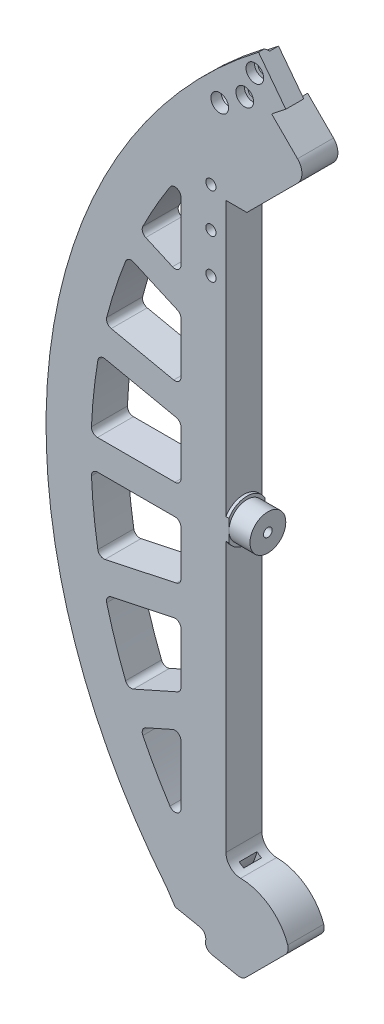
from build123d import *
from build123d.topology import SkipClean

# Parameters (mm, degrees)
AUFSATZ_LINEAR_AUSTRAGEN1_DEPTH       = 12
SKIZZE2_R                             = 5.975
AUFSATZ_LINEAR_AUSTRAGEN2_DEPTH       = 8
AUFSATZ_LINEAR_AUSTRAGEN3_DEPTH       = 1
SCHNITT_LINEAR_AUSTRAGEN1_DEPTH       = 255.841126979
VERRUNDUNG1_R                         = 2
VERRUNDUNG1_OF_SPIEGELN2_R            = 2
AUFSATZ_LINEAR_AUSTRAGEN4_DEPTH       = 12
SCHNITT_LINEAR_AUSTRAGEN2_DEPTH       = 255.841126979
VERRUNDUNG2_R                         = 5
VERRUNDUNG2_OF_SPIEGELN3_R            = 5
VERRUNDUNG3_R                         = 5
SCHNITT_LINEAR_AUSTRAGEN3_DEPTH       = 255.841126979
SKIZZE8_R                             = 217.169357413
SKIZZE8_R_2                           = 180
SCHNITT_LINEAR_AUSTRAGEN4_DEPTH       = 255.841126979
SKIZZE11_R                            = 1.7
SCHNITT_LINEAR_AUSTRAGEN6_DEPTH       = 255.841126979
AUFSATZ_LINEAR_AUSTRAGEN5_DEPTH       = 1
SKIZZE17_R                            = 1.7
SCHNITT_LINEAR_AUSTRAGEN9_DEPTH       = 255.841126979
SKIZZE17_7_R                          = 1.7
SCHNITT_LINEAR_AUSTRAGEN16_DEPTH      = 6
FASE1_SIZE                            = 1
SKIZZE21_R                            = 2.95
SCHNITT_LINEAR_AUSTRAGEN20_DEPTH      = 2.5
SCHNITT_LINEAR_AUSTRAGEN28_DEPTH      = 400.457969312
SKIZZE31_R                            = 2.9
SCHNITT_LINEAR_AUSTRAGEN29_DEPTH      = 6
SKIZZE33_R                            = 2.95
SCHNITT_LINEAR_AUSTRAGEN30_DEPTH      = 2.8
SKIZZE33_3_R                          = 2.95
SCHNITT_LINEAR_AUSTRAGEN44_DEPTH      = 4
FASE5_SIZE                            = 0.62
K_RPER_VERSCHIEBEN_KOPIEREN1_ANGLE    = 90
SCHNITT_ROTATION2_START               = -1.484065885
SCHNITT_ROTATION2_DEPTH               = 5.8
FASE2_SIZE                            = 1.1
SKIZZE37_R                            = 1.5
SCHNITT_LINEAR_AUSTRAGEN32_DEPTH      = 6
SCHNITT_LINEAR_AUSTRAGEN39_DEPTH      = 229.129577254
SCHNITT_LINEAR_AUSTRAGEN40_DEPTH      = 2.95
SKIZZE46_W                            = 20.526751733
SKIZZE46_H                            = 12
SCHNITT_LINEAR_AUSTRAGEN41_DEPTH      = 321.608809185
AUFSATZ_LINEAR_AUSTRAGEN10_REACH      = 322.609
SKIZZE47_W                            = 7.305884698
SKIZZE47_H                            = 12
SCHNITT_LINEAR_AUSTRAGEN42_REACH      = 322.609
SCHNITT_LINEAR_AUSTRAGEN42_END_RADIUS = 19.399208801
SKIZZE48_R                            = 1.45
VERRUNDUNG9_R                         = 3
VERRUNDUNG10_R                        = 2.5
FASE4_SIZE                            = 3.57
SKIZZE50_R                            = 1.45
SCHNITT_LINEAR_AUSTRAGEN43_DEPTH      = 8
SKIZZE51_R                            = 1.45
SCHNITT_LINEAR_AUSTRAGEN45_DEPTH      = 10


# Read off the part's stored shape, not the designer's step: Schnitt-Rotation2
with BuildPart() as part:
    # Skizze1 → Aufsatz-Linear austragen1 (new body)
    with BuildSketch(Plane(origin=(0, 0, 0), x_dir=(1, 0, 0), z_dir=(0, 1, 0))):
        with BuildLine():
            Line((-127.279220614, 127.279220614), (-120, 120))
            Line((-120, 120), (-120, -113.247516529))
            ThreePointArc((-120, -113.247516529), (0, -165), (120, -113.247516529))
            Line((120, -113.247516529), (120, 120))
            Line((120, 120), (127.279220614, 127.279220614))
            Line((127.279220614, 127.279220614), (122.965849596, 131.45113097))
            Line((122.965849596, 131.45113097), (124.380063158, 132.865344532))
            Line((124.380063158, 132.865344532), (132.865344532, 124.380063158))
            Line((132.865344532, 124.380063158), (131.45113097, 122.965849596))
            ThreePointArc((131.45113097, 122.965849596), (180, 0), (131.45113097, -122.965849596))
            Line((131.45113097, -122.965849596), (132.865344532, -124.380063158))
            Line((132.865344532, -124.380063158), (124.380063158, -132.865344532))
            Line((124.380063158, -132.865344532), (122.965849596, -131.45113097))
            ThreePointArc((122.965849596, -131.45113097), (66.101423681, -167.423420665), (0, -180))
            ThreePointArc((0, -180), (-66.101423681, -167.423420665), (-122.965849596, -131.45113097))
            Line((-122.965849596, -131.45113097), (-124.380063158, -132.865344532))
            Line((-124.380063158, -132.865344532), (-132.865344532, -124.380063158))
            Line((-132.865344532, -124.380063158), (-131.45113097, -122.965849596))
            ThreePointArc((-131.45113097, -122.965849596), (-180, 0), (-131.45113097, 122.965849596))
            Line((-131.45113097, 122.965849596), (-132.865344532, 124.380063158))
            Line((-132.865344532, 124.380063158), (-124.380063158, 132.865344532))
            Line((-124.380063158, 132.865344532), (-122.965849596, 131.45113097))
            Line((-122.965849596, 131.45113097), (-127.279220614, 127.279220614))
        make_face()
    extrude(amount=AUFSATZ_LINEAR_AUSTRAGEN1_DEPTH)

    # Skizze2 → Aufsatz-Linear austragen2 (add)
    with BuildSketch(Plane.ZY.offset(-120)):
        with Locations(Location((0, 6, 0), (0, 0, 180))):
            Circle(SKIZZE2_R)
    aufsatz_linear_austragen2 = extrude(amount=AUFSATZ_LINEAR_AUSTRAGEN2_DEPTH)

    # Skizze3 → Aufsatz-Linear austragen3 (add)
    with BuildSketch(Plane.ZY.offset(-120)):
        with BuildLine():
            Line((-3.55677171, 12), (3.55677171, 12))
            ThreePointArc((3.55677171, 12), (6.975, 6), (3.55677171, 0))
            Line((3.55677171, 0), (-3.55677171, 0))
            ThreePointArc((-3.55677171, 0), (-6.975, 6), (-3.55677171, 12))
        make_face()
    aufsatz_linear_austragen3 = extrude(amount=AUFSATZ_LINEAR_AUSTRAGEN3_DEPTH)

    # Spiegeln1: Aufsatz-Linear austragen2, Aufsatz-Linear austragen3 across plane
    add(aufsatz_linear_austragen2.mirror(Plane(origin=(0, 0, 0), x_dir=(0, 0, 1), z_dir=(1, 0, 0))))
    add(aufsatz_linear_austragen3.mirror(Plane(origin=(0, 0, 0), x_dir=(0, 0, 1), z_dir=(1, 0, 0))))

    # Skizze4 → Schnitt-Linear austragen1 (cut, through all)
    with BuildSketch(Plane(origin=(0, 12, 0), x_dir=(1, 0, 0), z_dir=(0, 1, 0))):
        with BuildLine():
            Line((135, 94.868329805), (135, 65.579053909))
            Line((135, 65.579053909), (148.632093411, 71.648452937))
            ThreePointArc((148.632093411, 71.648452937), (142.290483778, 83.536927322), (135, 94.868329805))
        make_face()
        with BuildLine():
            Line((135, 5), (164.924225025, 5))
            ThreePointArc((164.924225025, 5), (164.096112736, 17.247196439), (162.359793465, 29.398936478))
            Line((162.359793465, 29.398936478), (135, 23.583432851))
            Line((135, 23.583432851), (135, 5))
        make_face()
        with BuildLine():
            Line((135, 33.8068388), (160.280676557, 39.180412485))
            ThreePointArc((160.280676557, 39.180412485), (156.924325189, 50.987804072), (152.699459842, 62.51299836))
            Line((152.699459842, 62.51299836), (135, 54.632691124))
            Line((135, 54.632691124), (135, 33.8068388))
        make_face()
        with BuildLine():
            Line((135, -5), (164.924225025, -5))
            ThreePointArc((164.924225025, -5), (164.096112736, -17.247196439), (162.359793465, -29.398936478))
            Line((162.359793465, -29.398936478), (135, -23.583432851))
            Line((135, -23.583432851), (135, -5))
        make_face()
        with BuildLine():
            Line((135, -33.8068388), (160.280676557, -39.180412485))
            ThreePointArc((160.280676557, -39.180412485), (156.924325189, -50.987804072), (152.699459842, -62.51299836))
            Line((152.699459842, -62.51299836), (135, -54.632691124))
            Line((135, -54.632691124), (135, -33.8068388))
        make_face()
        with BuildLine():
            Line((135, -65.579053909), (148.632093411, -71.648452937))
            ThreePointArc((148.632093411, -71.648452937), (142.290483778, -83.536927322), (135, -94.868329805))
            Line((135, -94.868329805), (135, -65.579053909))
        make_face()
    schnitt_linear_austragen1 = extrude(amount=-SCHNITT_LINEAR_AUSTRAGEN1_DEPTH, mode=Mode.SUBTRACT)

    # Verrundung1
    verrundung1_edges = [part.edges().sort_by_distance(p)[0] for p in [
        (148.632093411, 6, 71.648452937),
        (135, 6, 94.868329805),
        (135, 6, 65.579053909),
        (135, 6, 54.632691124),
        (135, 6, 33.8068388),
        (160.280676557, 6, 39.180412485),
        (152.699459842, 6, 62.51299836),
        (135, 6, 23.583432851),
        (135, 6, 5),
        (164.924225025, 6, 5),
        (162.359793465, 6, 29.398936478),
        (135, 6, -33.8068388),
        (135, 6, -54.632691124),
        (152.699459842, 6, -62.51299836),
        (160.280676557, 6, -39.180412485),
        (135, 6, -94.868329805),
        (148.632093411, 6, -71.648452937),
        (135, 6, -65.579053909),
        (135, 6, -5),
        (135, 6, -23.583432851),
        (162.359793465, 6, -29.398936478),
        (164.924225025, 6, -5),
    ]]
    fillet(verrundung1_edges, radius=VERRUNDUNG1_R)

    # Spiegeln2: Schnitt-Linear austragen1 across plane
    add(schnitt_linear_austragen1.mirror(Plane(origin=(0, 0, 0), x_dir=(0, 0, 1), z_dir=(1, 0, 0))), mode=Mode.SUBTRACT)

    # Verrundung1 of Spiegeln2
    verrundung1_of_spiegeln2_edges = [part.edges().sort_by_distance(p)[0] for p in [
        (-148.632093411, 6, 71.648452937),
        (-135, 6, 94.868329805),
        (-135, 6, 65.579053909),
        (-135, 6, 54.632691124),
        (-135, 6, 33.8068388),
        (-160.280676557, 6, 39.180412485),
        (-152.699459842, 6, 62.51299836),
        (-135, 6, 23.583432851),
        (-135, 6, 5),
        (-164.924225025, 6, 5),
        (-162.359793465, 6, 29.398936478),
        (-135, 6, -33.8068388),
        (-135, 6, -54.632691124),
        (-152.699459842, 6, -62.51299836),
        (-160.280676557, 6, -39.180412485),
        (-135, 6, -94.868329805),
        (-148.632093411, 6, -71.648452937),
        (-135, 6, -65.579053909),
        (-135, 6, -5),
        (-135, 6, -23.583432851),
        (-162.359793465, 6, -29.398936478),
        (-164.924225025, 6, -5),
    ]]
    fillet(verrundung1_of_spiegeln2_edges, radius=VERRUNDUNG1_OF_SPIEGELN2_R)

    # Skizze6 → Aufsatz-Linear austragen4 (add)
    # profile 1 of 2: a face of its own
    with BuildSketch(Plane.XZ):
        Polygon((-115.343258147, 106.716555417), (-120, 111.37329727), (-120, 87.91767794), (-92.574419793, 115.343258147), (-104.731449678, 127.500288032), (-107.477197557, 126.300642478), (-112.279508622, 120.906211352), (-106.716555417, 115.343258147), align=None)
    # profile 2 of 2: a face of its own
    with BuildSketch(Plane.XZ):
        with BuildLine():
            Line((-127.279220614, -127.279220614), (-126.134036513, -104.18240391))
            Line((-126.134036513, -104.18240391), (-120, -99.118303438))
            ThreePointArc((-120, -99.118303438), (-99.000407319, -119.567666603), (-127.279220614, -127.279220614))
        make_face()
        Polygon((-123.969960878, -115.343258147), (-115.343258147, -106.716555417), (-106.716555417, -115.343258147), (-115.343258147, -123.969960878), align=None, mode=Mode.SUBTRACT)
    aufsatz_linear_austragen4 = extrude(amount=-AUFSATZ_LINEAR_AUSTRAGEN4_DEPTH)

    # Skizze6<3> → Schnitt-Linear austragen2 (cut, through all)
    with BuildSketch(Plane.XZ):
        Polygon((-115.343258147, 106.716555417), (-106.716555417, 115.343258147), (-115.343258147, 123.969960878), (-123.969960878, 115.343258147), align=None)
        Polygon((-115.343258147, -106.716555417), (-106.716555417, -115.343258147), (-115.343258147, -123.969960878), (-123.969960878, -115.343258147), align=None)
    schnitt_linear_austragen2 = extrude(amount=-SCHNITT_LINEAR_AUSTRAGEN2_DEPTH, mode=Mode.SUBTRACT)

    # Verrundung2
    verrundung2_edges = [part.edges().sort_by_distance(p)[0] for p in [
        (-92.574419793, 6, 115.343258147),
    ]]
    fillet(verrundung2_edges, radius=VERRUNDUNG2_R)

    # Spiegeln3: Aufsatz-Linear austragen4, Schnitt-Linear austragen2 across plane
    add(aufsatz_linear_austragen4.mirror(Plane(origin=(0, 0, 0), x_dir=(0, 0, 1), z_dir=(1, 0, 0))))
    add(schnitt_linear_austragen2.mirror(Plane(origin=(0, 0, 0), x_dir=(0, 0, 1), z_dir=(1, 0, 0))), mode=Mode.SUBTRACT)

    # Verrundung2 of Spiegeln3
    verrundung2_of_spiegeln3_edges = [part.edges().sort_by_distance(p)[0] for p in [
        (92.574419793, 6, 115.343258147),
    ]]
    fillet(verrundung2_of_spiegeln3_edges, radius=VERRUNDUNG2_OF_SPIEGELN3_R)

    # Verrundung3
    verrundung3_edges = [part.edges().sort_by_distance(p)[0] for p in [
        (-120, 6, -99.118303438),
    ]]
    fillet(verrundung3_edges, radius=VERRUNDUNG3_R)

    # Skizze7 → Schnitt-Linear austragen3 (cut, through all)
    with BuildSketch(Plane.XZ):
        Polygon((-120, 87.91767794), (-120, 94.91767794), (-113, 94.91767794), align=None)
    extrude(amount=-SCHNITT_LINEAR_AUSTRAGEN3_DEPTH, mode=Mode.SUBTRACT)

    # Skizze8 → Schnitt-Linear austragen4 (cut, through all)
    with SkipClean():  # the faces are left unmerged after this step: merging them gives an invalid solid
        with BuildSketch(Plane(origin=(0, 0, 0), x_dir=(1, 0, 0), z_dir=(0, 1, 0))):
            Circle(SKIZZE8_R)
            Circle(SKIZZE8_R_2, mode=Mode.SUBTRACT)
        extrude(amount=SCHNITT_LINEAR_AUSTRAGEN4_DEPTH, mode=Mode.SUBTRACT)

    # Skizze11 → Schnitt-Linear austragen6 (cut, through all)
    with SkipClean():  # the faces are left unmerged after this step: merging them gives an invalid solid
        with BuildSketch(Plane(origin=(0, 12, 0), x_dir=(1, 0, 0), z_dir=(0, 1, 0))):
            with Locations(Location((-125, -97, 0), (0, 0, 270))):
                Circle(SKIZZE11_R)
            with Locations(Location((-125, -83.82, 0), (0, 0, 270))):
                Circle(SKIZZE11_R)
            with Locations(Location((-125, -70.64, 0), (0, 0, 270))):
                Circle(SKIZZE11_R)
        extrude(amount=-SCHNITT_LINEAR_AUSTRAGEN6_DEPTH, mode=Mode.SUBTRACT)

    # Skizze12 → Aufsatz-Linear austragen5 (add)
    with SkipClean():  # the faces are left unmerged after this step: merging them gives an invalid solid
        with BuildSketch(Plane.XZ):
            Polygon((-115.343258147, 123.969960878), (-106.716555417, 115.343258147), (-115.343258147, 106.716555417), (-123.969960878, 115.343258147), align=None)
            Polygon((123.969960878, 115.343258147), (115.343258147, 123.969960878), (106.716555417, 115.343258147), (115.343258147, 106.716555417), align=None)
            Polygon((115.343258147, -123.969960878), (106.716555417, -115.343258147), (115.343258147, -106.716555417), (123.969960878, -115.343258147), align=None)
            Polygon((-123.969960878, -115.343258147), (-115.343258147, -123.969960878), (-106.716555417, -115.343258147), (-115.343258147, -106.716555417), align=None)
        extrude(amount=-AUFSATZ_LINEAR_AUSTRAGEN5_DEPTH)

    # Skizze17 → Schnitt-Linear austragen9 (cut, through all)
    with SkipClean():  # the faces are left unmerged after this step: merging them gives an invalid solid
        with BuildSketch(Plane(origin=(0, 12, 0), x_dir=(1, 0, 0), z_dir=(0, 1, 0))):
            with Locations(Location((-122.060772568, -122.060772568, 0), (0, 0, 270))):
                Circle(SKIZZE17_R)
            with Locations(Location((-113.71691255, -128.00046953, 0), (0, 0, 270))):
                Circle(SKIZZE17_R)
            with Locations(Location((-110.347991921, -136.514729866, 0), (0, 0, 270))):
                Circle(SKIZZE17_R)
        schnitt_linear_austragen9 = extrude(amount=-SCHNITT_LINEAR_AUSTRAGEN9_DEPTH, mode=Mode.SUBTRACT)

    # Skizze17<7> → Schnitt-Linear austragen16 (cut)
    with SkipClean():  # the faces are left unmerged after this step: merging them gives an invalid solid
        with BuildSketch(Plane(origin=(0, 12, 0), x_dir=(1, 0, 0), z_dir=(0, 1, 0))):
            Polygon((-129.954981725, -137.434890651), (-111.481289104, -146.249211371), (-99.867474616, -131.01337024), (-104.731449678, -127.500288032), (-111.80251749, -120.42922022), (-115.343258147, -123.969960878), (-123.969960878, -115.343258147), (-131.51946364, -122.892760909), align=None)
            with Locations(Location((-113.71691255, -128.00046953, 0), (0, 0, 270))):
                Circle(SKIZZE17_7_R, mode=Mode.SUBTRACT)
            with Locations(Location((-110.347991921, -136.514729866, 0), (0, 0, 270))):
                Circle(SKIZZE17_7_R, mode=Mode.SUBTRACT)
            with Locations(Location((-122.060772568, -122.060772568, 0), (0, 0, 270))):
                Circle(SKIZZE17_7_R, mode=Mode.SUBTRACT)
        extrude(amount=-SCHNITT_LINEAR_AUSTRAGEN16_DEPTH, mode=Mode.SUBTRACT)

    # Spiegeln8: Schnitt-Linear austragen9 across plane
    with SkipClean():  # the faces are left unmerged after this step: merging them gives an invalid solid
        add(schnitt_linear_austragen9.mirror(Plane(origin=(0, 0, 0), x_dir=(0, 0, 1), z_dir=(1, 0, 0))), mode=Mode.SUBTRACT)

    # Fase1
    fase1_edges = [part.edges().sort_by_distance(p)[0] for p in [
        (-179.999993048, 12, -0.050028267),
    ]]
    chamfer(fase1_edges, length=FASE1_SIZE)

    # Skizze21 → Schnitt-Linear austragen20 (cut)
    with SkipClean():  # the faces are left unmerged after this step: merging them gives an invalid solid
        with BuildSketch(Plane(origin=(0, 12, 0), x_dir=(1, 0, 0), z_dir=(0, 1, 0))):
            with Locations((-122.060772568, -122.060772568)):
                Circle(SKIZZE21_R)
            with Locations((-113.71691255, -128.00046953)):
                Circle(SKIZZE21_R)
            with Locations((-110.347991921, -136.514729866)):
                Circle(SKIZZE21_R)
            with Locations(Location((110.347991921, -136.514729866, 0), (0, 0, 90))):
                Circle(SKIZZE21_R)
            with Locations(Location((113.71691255, -128.00046953, 0), (0, 0, 90))):
                Circle(SKIZZE21_R)
            with Locations(Location((122.060772568, -122.060772568, 0), (0, 0, 90))):
                Circle(SKIZZE21_R)
        extrude(amount=-SCHNITT_LINEAR_AUSTRAGEN20_DEPTH, mode=Mode.SUBTRACT)

    # Skizze29 → Schnitt-Linear austragen28 (cut, through all)
    with SkipClean():  # the faces are left unmerged after this step: merging them gives an invalid solid
        with BuildSketch(Plane(origin=(-109.120796797, 0, 143.152546978), x_dir=(0.7952919276581147, 0, 0.6062266488713937), z_dir=(-0.6062266488713937, 0, 0.7952919276581147))):
            Polygon((0, 12), (0, -9.771833037), (123.295870212, -52.769688315), (243.137893101, -38.974923091), (225.678893364, 65.779075334), (63.805945181, 70.521025879), (0, 48.10453239), align=None)
        extrude(amount=-SCHNITT_LINEAR_AUSTRAGEN28_DEPTH, mode=Mode.SUBTRACT)

    # Skizze31 → Schnitt-Linear austragen29 (cut)
    with SkipClean():  # the faces are left unmerged after this step: merging them gives an invalid solid
        with BuildSketch(Plane(origin=(0, 12, 0), x_dir=(1, 0, 0), z_dir=(0, 1, 0))):
            with Locations(Location((-125, -70.64, 0), (0, 0, 270))):
                Circle(SKIZZE31_R)
            with Locations(Location((-125, -83.82, 0), (0, 0, 270))):
                Circle(SKIZZE31_R)
            with Locations(Location((-125, -97, 0), (0, 0, 270))):
                Circle(SKIZZE31_R)
        extrude(amount=-SCHNITT_LINEAR_AUSTRAGEN29_DEPTH, mode=Mode.SUBTRACT)

    # Skizze33 → Schnitt-Linear austragen30 (cut)
    with SkipClean():  # the faces are left unmerged after this step: merging them gives an invalid solid
        with BuildSketch(Plane.XZ):
            with Locations(Location((-113.71691255, 128.00046953, 0), (0, 0, 270))):
                Circle(SKIZZE33_R)
            with Locations(Location((-110.347991921, 136.514729866, 0), (0, 0, 270))):
                Circle(SKIZZE33_R)
        extrude(amount=-SCHNITT_LINEAR_AUSTRAGEN30_DEPTH, mode=Mode.SUBTRACT)

    # Skizze33<3> → Schnitt-Linear austragen44 (cut)
    with SkipClean():  # the faces are left unmerged after this step: merging them gives an invalid solid
        with BuildSketch(Plane.XZ):
            with Locations(Location((-122.060772568, 122.060772568, 0), (0, 0, 270))):
                Circle(SKIZZE33_3_R)
        extrude(amount=-SCHNITT_LINEAR_AUSTRAGEN44_DEPTH, mode=Mode.SUBTRACT)

    # Fase5
    fase5_edges = [part.edges().sort_by_distance(p)[0] for p in [
        (-122.060772568, 4, 125.010772568),
        (-122.060772568, 4, 120.360772568),
    ]]
    chamfer(fase5_edges, length=FASE5_SIZE)


with BuildPart() as part_1:
    # Körper-Verschieben/Kopieren1: moved
    add(part.part.rotate(Axis((0, 1.951289699, 5.464644416), (-1, 0, 0)), K_RPER_VERSCHIEBEN_KOPIEREN1_ANGLE))

    # Schnitt-Rotation2 outline → Schnitt-Rotation2 (cut)
    with BuildSketch(Plane.XY.offset(SCHNITT_ROTATION2_START)):
        with BuildLine():
            ThreePointArc((-126.874722265, -131.183807813), (-124.569198659, -132.992256524), (-121.985669867, -134.374756005))
            ThreePointArc((-121.985669867, -134.374756005), (-178.68086077, 5.338763354), (-108.453947483, 138.764371141))
            Line((-108.453947483, 138.764371141), (-109.120796797, 139.639192262))
            ThreePointArc((-109.120796797, 139.639192262), (-179.771654729, 5.550427932), (-122.965849596, -134.964485686))
            Line((-122.965849596, -134.964485686), (-126.874722265, -131.183807813))
        make_face()
    extrude(amount=SCHNITT_ROTATION2_DEPTH, mode=Mode.SUBTRACT)

    # Fase2
    fase2_edges = [part_1.edges().sort_by_distance(p)[0] for p in [
        (-179.999993047, -3.563382983, -1.484065885),
        (-180, -3.513354717, 4.315934115),
    ]]
    chamfer(fase2_edges, length=FASE2_SIZE - 0.0001)  # a hair under: the kernel refuses the full size

    # Skizze37 → Schnitt-Linear austragen32 (cut)
    with BuildSketch(Plane(origin=(0, 0, -4.584065885), x_dir=(-1, 0, 0), z_dir=(0, 0, -1))):
        with Locations(Location((136.746021663, -3.513354717, 0), (0, 0, 90))):
            Circle(SKIZZE37_R)
        with Locations(Location((163.246021663, -3.513354717, 0), (0, 0, 90))):
            Circle(SKIZZE37_R)
    extrude(amount=-SCHNITT_LINEAR_AUSTRAGEN32_DEPTH, mode=Mode.SUBTRACT)

    # Skizze43 → Schnitt-Linear austragen39 (cut, through all)
    with BuildSketch(Plane(origin=(0, 0, -4.584065885), x_dir=(-1, 0, 0), z_dir=(0, 0, -1))):
        Polygon((98.853828028, -115.246475148), (114.495270283, -130.887917403), (132.055248239, -127.36804616), (132.785654922, -136.258035369), (118.151999592, -141.358205804), (102.106903175, -142.659519406), (88.19196428, -122.667333722), align=None)
    extrude(amount=-SCHNITT_LINEAR_AUSTRAGEN39_DEPTH, mode=Mode.SUBTRACT)

    # Skizze44 → Schnitt-Linear austragen40 (cut, symmetric)
    with BuildSketch(Plane(origin=(0, 0, 1.415934115), x_dir=(-1, 0, 0), z_dir=(0, 0, -1))):
        with BuildLine():
            Line((139.597468474, -115.555966234), (141.176868695, -113.396482382))
            ThreePointArc((141.176868695, -113.396482382), (127.039401443, -111.900159268), (118.563159088, -100.486996749))
            Line((118.563159088, -100.486996749), (117.070712351, -101.530365939))
            ThreePointArc((117.070712351, -101.530365939), (125.560837576, -112.997334821), (139.597468474, -115.555966234))
        make_face()
    extrude(amount=SCHNITT_LINEAR_AUSTRAGEN40_DEPTH, both=True, mode=Mode.SUBTRACT)

    # Skizze46 → Schnitt-Linear austragen41 (cut, through all)
    with SkipClean():  # the faces are left unmerged after this step: merging them gives an invalid solid
        with BuildSketch(Plane(origin=(-28.643298237, -142.89604669, 0), x_dir=(0.9804960167130297, -0.19653895596009066, -6.524242016866202e-14), z_dir=(0.19653895596009066, 0.9804960167130297, 3.2548220673910937e-13))):
            with Locations((-109.820957749, -1.415934115)):
                Rectangle(SKIZZE46_W, SKIZZE46_H)
        extrude(amount=-SCHNITT_LINEAR_AUSTRAGEN41_DEPTH, mode=Mode.SUBTRACT)

    # Skizze47 → Aufsatz-Linear austragen10 (add, up to next)
    with BuildSketch(Plane(origin=(-28.643298237, -142.89604669, 0), x_dir=(0.9804960167130297, -0.19653895596009066, -6.524242016866202e-14), z_dir=(0.19653895596009066, 0.9804960167130297, 3.2548220673910937e-13)), mode=Mode.PRIVATE) as aufsatz_linear_austragen10_sk1:
        with Locations((-110.355685082, -1.415934115)):
            Rectangle(SKIZZE47_W, SKIZZE47_H)
    aufsatz_linear_austragen10_tool1 = extrude(aufsatz_linear_austragen10_sk1.sketch, amount=AUFSATZ_LINEAR_AUSTRAGEN10_REACH, mode=Mode.PRIVATE) - part_1.part
    add(aufsatz_linear_austragen10_tool1.solids().sort_by_distance((-136.846608, -121.206856, 1.415934))[0])

    # Schnitt-Linear austragen42: up to this cylinder (the profile starts outside it)
    with SkipClean():  # the faces are left unmerged after this step: merging them gives an invalid solid
        schnitt_linear_austragen42_end = Plane(origin=(-135.814193572, -96.529244679, 1.415934), z_dir=(0, 0, -1)) * Cylinder(SCHNITT_LINEAR_AUSTRAGEN42_END_RADIUS, 685.016417602, mode=Mode.PRIVATE)
        # Skizze48 → Schnitt-Linear austragen42 (cut, up to the surface)
        with BuildSketch(Plane(origin=(-28.643298237, -142.89604669, 0), x_dir=(0.9804960167130297, -0.19653895596009044, -6.546062224280144e-14), z_dir=(-0.19653895596009047, -0.9804960167130298, -3.265707759924017e-13)), mode=Mode.PRIVATE) as schnitt_linear_austragen42_sk1:
            with Locations((-105.083260477, 1.415934115)):
                Circle(SKIZZE48_R)
        schnitt_linear_austragen42_tool1 = extrude(schnitt_linear_austragen42_sk1.sketch, amount=-SCHNITT_LINEAR_AUSTRAGEN42_REACH, mode=Mode.PRIVATE) - schnitt_linear_austragen42_end
        add(schnitt_linear_austragen42_tool1.solids().sort_by_distance((-131.677017, -122.243092, 1.415934))[0], mode=Mode.SUBTRACT)

    # Verrundung9
    verrundung9_edges = [part_1.edges().sort_by_distance(p)[0] for p in [
        (-114.495270283, -130.887917403, 1.415934115),
        (-98.853828028, -115.246475148, 1.415934115),
    ]]
    fillet(verrundung9_edges, radius=VERRUNDUNG9_R)

    # Verrundung10
    verrundung10_edges = [part_1.edges().sort_by_distance(p)[0] for p in [
        (-127.261328491, -128.328980183, 1.415934115),
        (-126.259110706, -123.329103489, 1.415934115),
    ]]
    fillet(verrundung10_edges, radius=VERRUNDUNG10_R)

    # Fase4
    fase4_edges = [part_1.edges().sort_by_distance(p)[0] for p in [
        (-140.428303304, -120.488910085, 1.415934115),
    ]]
    chamfer(fase4_edges, length=FASE4_SIZE)

    # Skizze50 → Schnitt-Linear austragen43 (cut)
    with SkipClean():  # the faces are left unmerged after this step: merging them gives an invalid solid
        with BuildSketch(Plane(origin=(0, 0, -4.584065885), x_dir=(-1, 0, 0), z_dir=(0, 0, -1))):
            with Locations(Location((108.625743726, 105.112389009, 0), (0, 0, 90))):
                Circle(SKIZZE50_R)
            with Locations(Location((108.625743726, -112.139098443, 0), (0, 0, 90))):
                Circle(SKIZZE50_R)
            with Locations(Location((122.060772568, -125.574127285, 0), (0, 0, 270))):
                Circle(SKIZZE50_R)
        extrude(amount=-SCHNITT_LINEAR_AUSTRAGEN43_DEPTH, mode=Mode.SUBTRACT)

    # Skizze51 → Schnitt-Linear austragen45 (cut)
    with SkipClean():  # the faces are left unmerged after this step: merging them gives an invalid solid
        with BuildSketch(Plane(origin=(-112, 0, 0), x_dir=(0, 0, -1), z_dir=(1, 0, 0))):
            with Locations((-1.415934115, -3.513354717)):
                Circle(SKIZZE51_R)
        extrude(amount=-SCHNITT_LINEAR_AUSTRAGEN45_DEPTH, mode=Mode.SUBTRACT)


solid = part_1.part
